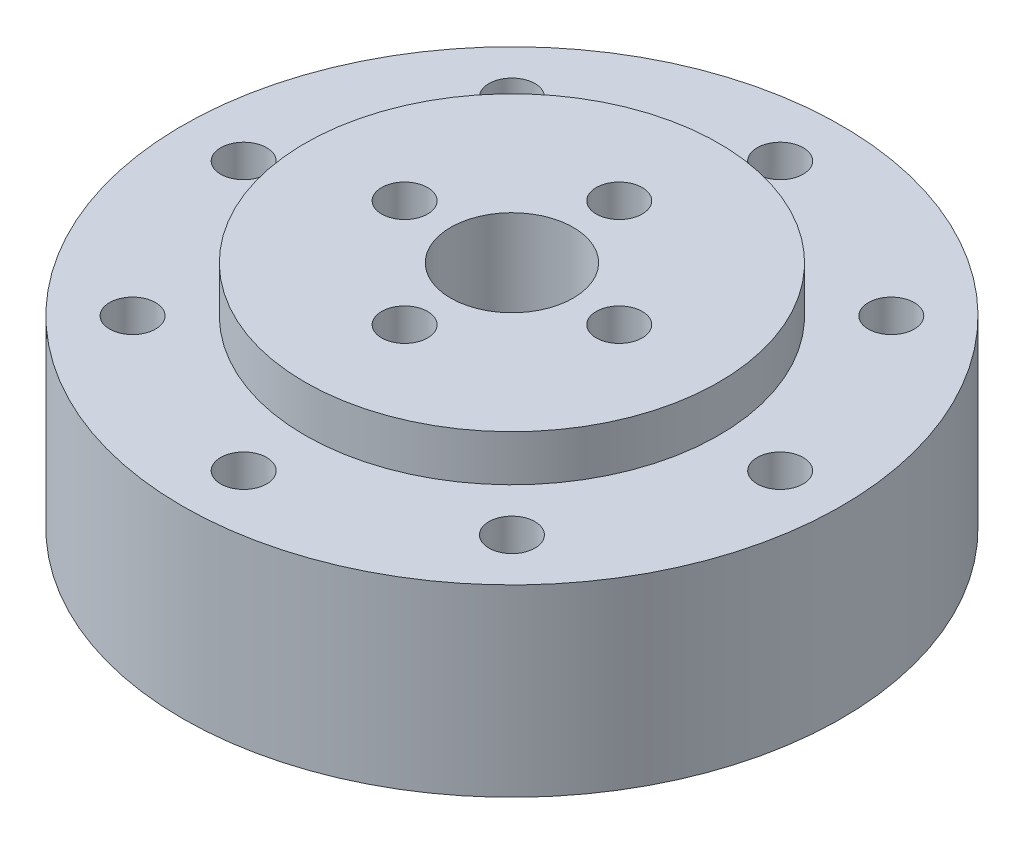
from build123d import *

# Parameters (mm, degrees)
SKETCH_1_R            = 21.5
SKETCH_1_R_2          = 1.5
SKETCH_1_R_3          = 10
EXTRUDE_1_DEPTH       = 9
SHELL_4_T             = -2
EXTRUDE_2_OUTLINE_R   = 21.5
EXTRUDE_2_OUTLINE_R_2 = 1.5
EXTRUDE_2_OUTLINE_R_3 = 4
EXTRUDE_2_DEPTH       = 3
SKETCH_5_R            = 13.5
SKETCH_5_R_2          = 1.5
SKETCH_5_R_3          = 4
EXTRUDE_3_DEPTH       = 3


# Read off the part's stored shape, not the designer's step: 凸台-拉伸2
with BuildPart() as part:
    # 草图1 → 凸台-拉伸1 (new body)
    with BuildSketch(Plane(origin=(0, 0, 0), x_dir=(1, 0, 0), z_dir=(0, 1, 0))):
        with Locations(Location((0, 0, 0), (0, 0, 270))):
            Circle(SKETCH_1_R)
        with Locations(Location((12.374368671, 12.374368671, 0), (0, 0, 270))):
            Circle(SKETCH_1_R_2, mode=Mode.SUBTRACT)
        with Locations(Location((0, 0, 0), (0, 0, 270))):
            Circle(SKETCH_1_R_3, mode=Mode.SUBTRACT)
        with Locations(Location((12.374368671, -12.374368671, 0), (0, 0, 90))):
            Circle(SKETCH_1_R_2, mode=Mode.SUBTRACT)
        with Locations(Location((-12.374368671, -12.374368671, 0), (0, 0, 270))):
            Circle(SKETCH_1_R_2, mode=Mode.SUBTRACT)
        with Locations(Location((-12.374368671, 12.374368671, 0), (0, 0, 90))):
            Circle(SKETCH_1_R_2, mode=Mode.SUBTRACT)
        with Locations(Location((0, 17.5, 0), (0, 0, 90))):
            Circle(SKETCH_1_R_2, mode=Mode.SUBTRACT)
        with Locations(Location((17.5, 0, 0), (0, 0, 270))):
            Circle(SKETCH_1_R_2, mode=Mode.SUBTRACT)
        with Locations(Location((0, -17.5, 0), (0, 0, 90))):
            Circle(SKETCH_1_R_2, mode=Mode.SUBTRACT)
        with Locations(Location((-17.5, 0, 0), (0, 0, 270))):
            Circle(SKETCH_1_R_2, mode=Mode.SUBTRACT)
    extrude(amount=EXTRUDE_1_DEPTH)

    # 抽壳4
    shell_4_openings = [part.faces().sort_by_distance(p)[0] for p in [
        (0, 9, -20.891888168),
    ]]
    offset(amount=SHELL_4_T, openings=shell_4_openings, kind=Kind.INTERSECTION)

    # 凸台-拉伸2 outline → 凸台-拉伸2 (add)
    with BuildSketch(Plane(origin=(0, 9, 0), x_dir=(1, 0, 0), z_dir=(0, 1, 0))):
        Circle(EXTRUDE_2_OUTLINE_R)
        with Locations((-12.374368671, -12.374368671)):
            Circle(EXTRUDE_2_OUTLINE_R_2, mode=Mode.SUBTRACT)
        with Locations((0, -17.5)):
            Circle(EXTRUDE_2_OUTLINE_R_2, mode=Mode.SUBTRACT)
        with Locations((12.374368671, -12.374368671)):
            Circle(EXTRUDE_2_OUTLINE_R_2, mode=Mode.SUBTRACT)
        with Locations((0, -7)):
            Circle(EXTRUDE_2_OUTLINE_R_2, mode=Mode.SUBTRACT)
        with Locations((-17.5, 0)):
            Circle(EXTRUDE_2_OUTLINE_R_2, mode=Mode.SUBTRACT)
        with Locations((-7, 0)):
            Circle(EXTRUDE_2_OUTLINE_R_2, mode=Mode.SUBTRACT)
        with Locations((-12.374368671, 12.374368671)):
            Circle(EXTRUDE_2_OUTLINE_R_2, mode=Mode.SUBTRACT)
        Circle(EXTRUDE_2_OUTLINE_R_3, mode=Mode.SUBTRACT)
        with Locations((7, 0)):
            Circle(EXTRUDE_2_OUTLINE_R_2, mode=Mode.SUBTRACT)
        with Locations((0, 7)):
            Circle(EXTRUDE_2_OUTLINE_R_2, mode=Mode.SUBTRACT)
        with Locations((17.5, 0)):
            Circle(EXTRUDE_2_OUTLINE_R_2, mode=Mode.SUBTRACT)
        with Locations((0, 17.5)):
            Circle(EXTRUDE_2_OUTLINE_R_2, mode=Mode.SUBTRACT)
        with Locations((12.374368671, 12.374368671)):
            Circle(EXTRUDE_2_OUTLINE_R_2, mode=Mode.SUBTRACT)
    extrude(amount=EXTRUDE_2_DEPTH)

    # 草图5 → 凸台-拉伸3 (add)
    with BuildSketch(Plane(origin=(0, 12, 0), x_dir=(1, 0, 0), z_dir=(0, 1, 0))):
        with Locations(Location((0, 0, 0), (0, 0, 270))):
            Circle(SKETCH_5_R)
        with Locations(Location((-7, 0, 0), (0, 0, 270))):
            Circle(SKETCH_5_R_2, mode=Mode.SUBTRACT)
        with Locations(Location((0, -7, 0), (0, 0, 270))):
            Circle(SKETCH_5_R_2, mode=Mode.SUBTRACT)
        with Locations(Location((7, 0, 0), (0, 0, 270))):
            Circle(SKETCH_5_R_2, mode=Mode.SUBTRACT)
        with Locations(Location((0, 0, 0), (0, 0, 270))):
            Circle(SKETCH_5_R_3, mode=Mode.SUBTRACT)
        with Locations(Location((0, 7, 0), (0, 0, 270))):
            Circle(SKETCH_5_R_2, mode=Mode.SUBTRACT)
    extrude(amount=EXTRUDE_3_DEPTH)


solid = part.part
